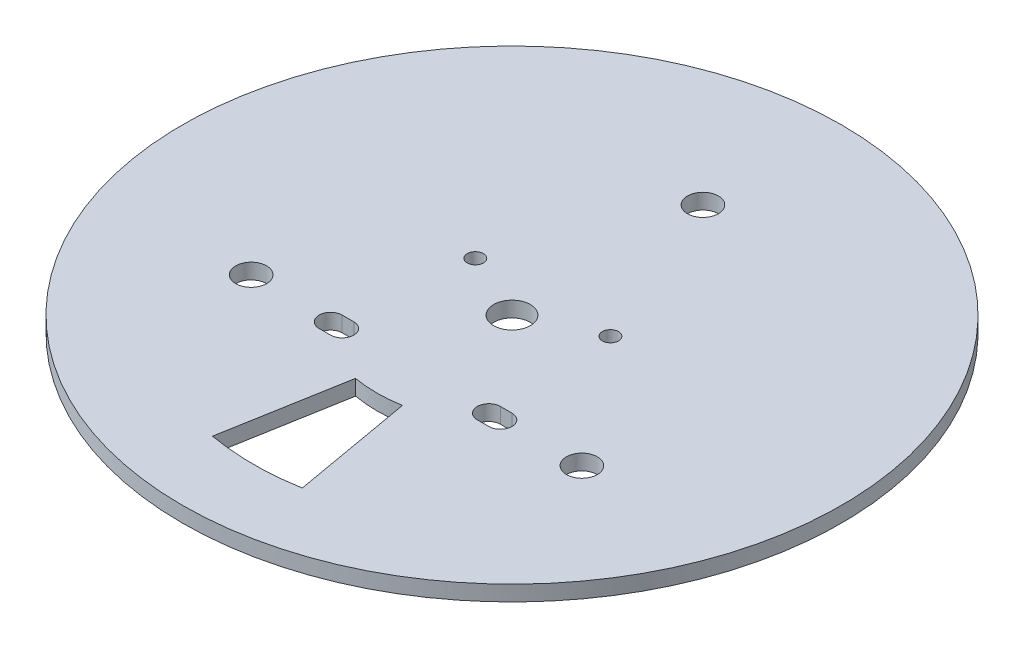
from build123d import *

# Parameters (mm, degrees)
ESBO_O1_R                = 85.4
RESSALTO_EXTRUS_O1_DEPTH = 4
CORTE_EXTRUS_O2_DEPTH    = 121.840059583
ESBO_O4_R                = 4
CORTE_EXTRUS_O3_DEPTH    = 121.840059583
ESBO_O5_R                = 4.75
CORTE_EXTRUS_O4_DEPTH    = 121.840059583
ESBO_O7_R                = 2.1
CORTE_EXTRUS_O5_DEPTH    = 121.840059583


with BuildPart() as part:
    # Esboço1 → Ressalto-extrusão1 (new body)
    with BuildSketch(Plane(origin=(0, 0, 0), x_dir=(1, 0, 0), z_dir=(0, 1, 0))):
        Circle(ESBO_O1_R)
    extrude(amount=RESSALTO_EXTRUS_O1_DEPTH)

    # Esboço3 → Corte-extrusão2 (cut, through all)
    with BuildSketch(Plane.XZ):
        with BuildLine():
            Line((6.077686218, 34.468271355), (11.634427904, 65.982119452))
            ThreePointArc((11.634427904, 65.982119452), (0, 67), (-11.634427904, 65.982119452))
            Line((-11.634427904, 65.982119452), (-6.077686218, 34.468271355))
            ThreePointArc((-6.077686218, 34.468271355), (0, 35), (6.077686218, 34.468271355))
        make_face()
    extrude(amount=-CORTE_EXTRUS_O2_DEPTH, mode=Mode.SUBTRACT)

    # Esboço4 → Corte-extrusão3 (cut, through all)
    with BuildSketch(Plane(origin=(0, 4, 0), x_dir=(1, 0, 0), z_dir=(0, 1, 0))):
        with Locations((42.850936979, -24.74)):
            Circle(ESBO_O4_R)
        with Locations((0, 49.48)):
            Circle(ESBO_O4_R)
        with Locations((-42.850936979, -24.74)):
            Circle(ESBO_O4_R)
    extrude(amount=-CORTE_EXTRUS_O3_DEPTH, mode=Mode.SUBTRACT)

    # Esboço5 → Corte-extrusão4 (cut, through all)
    with BuildSketch(Plane.XZ):
        Circle(ESBO_O5_R)
    extrude(amount=-CORTE_EXTRUS_O4_DEPTH, mode=Mode.SUBTRACT)

    # Esboço7 → Corte-extrusão5 (cut, through all)
    with BuildSketch(Plane(origin=(0, 4, 0), x_dir=(1, 0, 0), z_dir=(0, 1, 0))):
        with Locations((-17.5, 8)):
            Circle(ESBO_O7_R)
        with Locations((17.5, 8)):
            Circle(ESBO_O7_R)
        with BuildLine():
            Line((-22, -22), (-19, -22))
            ThreePointArc((-19, -22), (-16, -25), (-19, -28))
            Line((-19, -28), (-22, -28))
            ThreePointArc((-22, -28), (-25, -25), (-22, -22))
        make_face()
        with BuildLine():
            Line((19, -28), (22, -28))
            ThreePointArc((22, -28), (25, -25), (22, -22))
            Line((22, -22), (19, -22))
            ThreePointArc((19, -22), (16, -25), (19, -28))
        make_face()
    extrude(amount=-CORTE_EXTRUS_O5_DEPTH, mode=Mode.SUBTRACT)


solid = part.part
